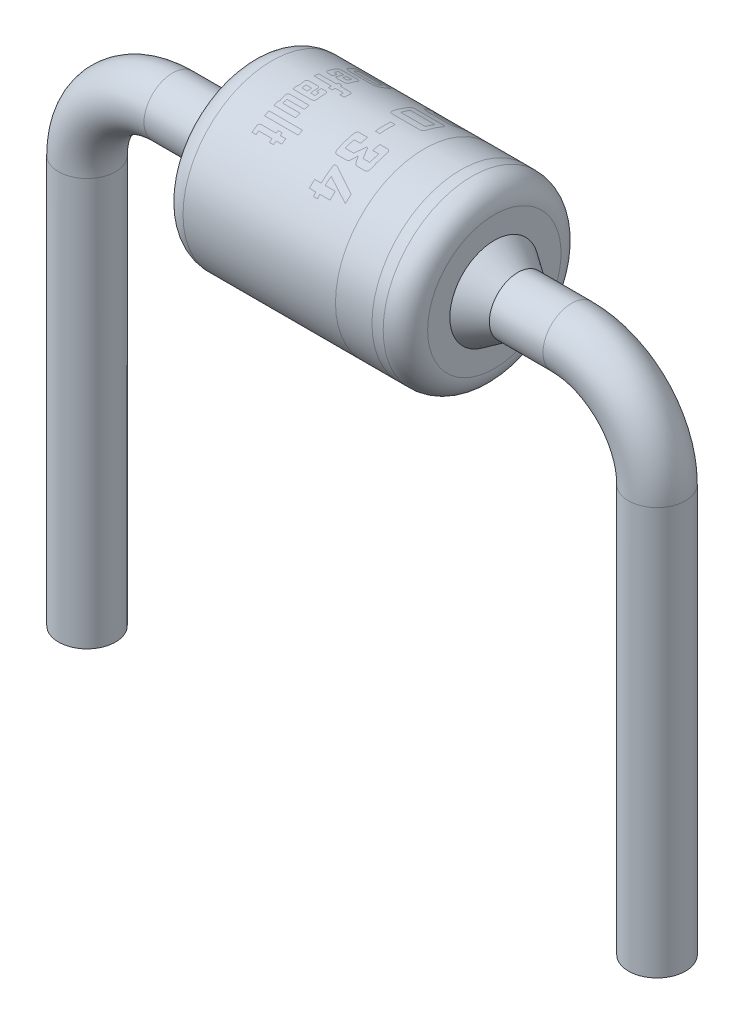
from build123d import *

# Parameters (mm, degrees)
SKETCH6_R = 0.254


with BuildPart() as part:
    # Sketch10 → BODY_main (revolve)
    with BuildSketch(Plane.XY):
        with BuildLine():
            Line((1.648125, 2.585), (3.431875, 2.585))
            ThreePointArc((3.431875, 2.585), (3.571970531, 2.526970531), (3.63, 2.386875))
            Line((3.63, 2.386875), (3.63, 2.18875))
            Line((3.63, 2.18875), (1.45, 2.18875))
            Line((1.45, 2.18875), (1.45, 2.386875))
            ThreePointArc((1.45, 2.386875), (1.508029469, 2.526970531), (1.648125, 2.585))
        make_face()
    revolve(axis=Axis((1.24, 1.7925, 0), (1, 0, 0)))

    # Sketch11 → BODY_to_PIN (revolve)
    with BuildSketch(Plane.XY):
        Polygon((1.24, 1.7925), (1.24, 2.0465), (1.45, 2.18875), (1.65, 2.18875), (1.65, 1.7925), align=None)
        Polygon((3.43, 1.7925), (3.43, 2.18875), (3.63, 2.18875), (3.84, 2.0465), (3.84, 1.7925), align=None)
    revolve(axis=Axis((1.24, 1.7925, 0), (1, 0, 0)))

    # PINS: sweep along a path in Sketch7
    with BuildLine(Plane.XY) as pins_path:
        Line((0, -2.6), (0, 1.0305))
        ThreePointArc((0, 1.0305), (0.223184633, 1.569315367), (0.762, 1.7925))
        Line((0.762, 1.7925), (4.318, 1.7925))
        ThreePointArc((4.318, 1.7925), (4.856815367, 1.569315367), (5.08, 1.0305))
        Line((5.08, 1.0305), (5.08, -2.6))
    # Sketch6 → PINS (sweep)
    with BuildSketch(Plane(origin=(2.54, 0, 0), x_dir=(0, 0, -1), z_dir=(1, 0, 0))):
        with Locations((0, 1.7925)):
            Circle(SKETCH6_R)
    sweep(path=pins_path.line)


solid = part.part
